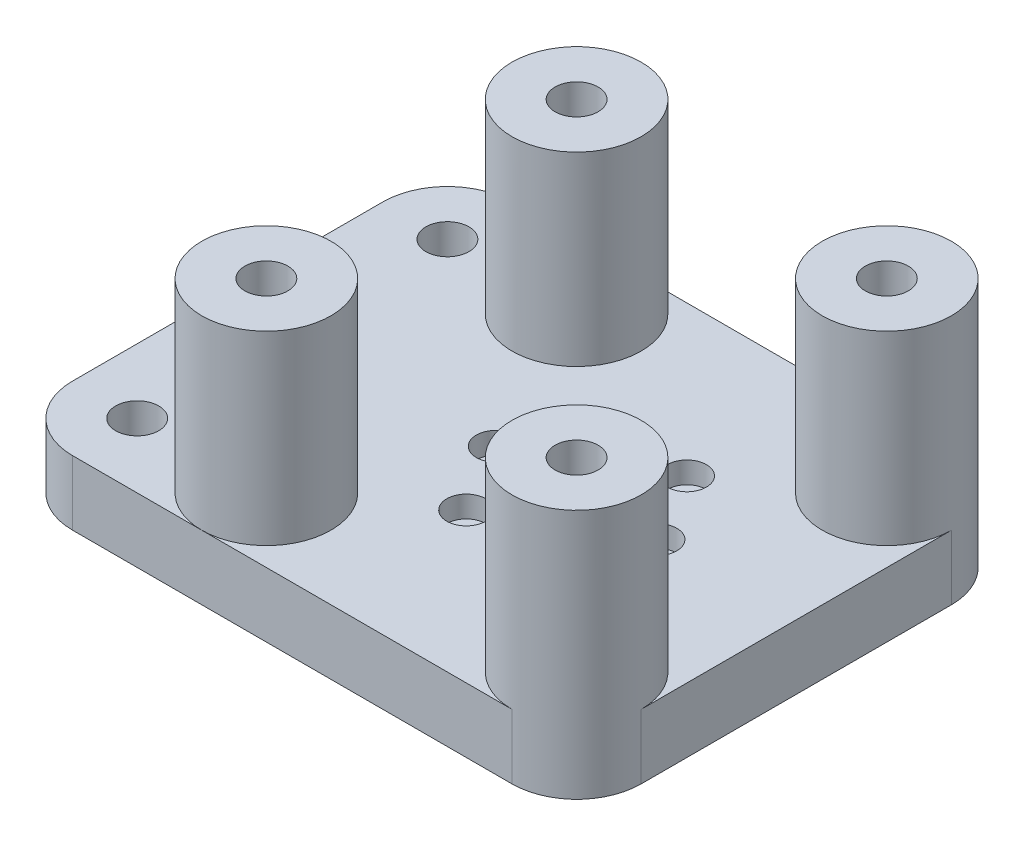
from build123d import *

# Parameters (mm, degrees)
SKETCH1_R                = 4
SKETCH1_R_2              = 10.5
SKETCH1_R_3              = 2
BASE_DEPTH               = 12
SKETCH2_R                = 3.625
BOLT_HEAD_RECESSES_DEPTH = 4
SKETCH3_R                = 12
SKETCH3_R_2              = 4
BOSS_EXTRUDE1_DEPTH      = 34.5


with BuildPart() as part:
    # Sketch1 → base (new body)
    with BuildSketch(Plane(origin=(0, 0, 0), x_dir=(1, 0, 0), z_dir=(0, 1, 0))):
        with BuildLine():
            Line((-52.814601333, 40.814601333), (28.814601333, 40.814601333))
            ThreePointArc((28.814601333, 40.814601333), (37.299882708, 37.299882708), (40.814601333, 28.814601333))
            Line((40.814601333, 28.814601333), (40.814601333, -28.814601333))
            ThreePointArc((40.814601333, -28.814601333), (37.299882708, -37.299882708), (28.814601333, -40.814601333))
            Line((28.814601333, -40.814601333), (-52.814601333, -40.814601333))
            ThreePointArc((-52.814601333, -40.814601333), (-61.299882708, -37.299882708), (-64.814601333, -28.814601333))
            Line((-64.814601333, -28.814601333), (-64.814601333, 28.814601333))
            ThreePointArc((-64.814601333, 28.814601333), (-61.299882708, 37.299882708), (-52.814601333, 40.814601333))
        make_face()
        with Locations((-28.814601333, 28.814601333)):
            Circle(SKETCH1_R, mode=Mode.SUBTRACT)
        with Locations((28.814601333, 28.814601333)):
            Circle(SKETCH1_R, mode=Mode.SUBTRACT)
        with Locations((28.814601333, -28.814601333)):
            Circle(SKETCH1_R, mode=Mode.SUBTRACT)
        with Locations((-28.814601333, -28.814601333)):
            Circle(SKETCH1_R, mode=Mode.SUBTRACT)
        Circle(SKETCH1_R_2, mode=Mode.SUBTRACT)
        with Locations((-7.5, 12.990381057)):
            Circle(SKETCH1_R_3, mode=Mode.SUBTRACT)
        with Locations((7.5, 12.990381057)):
            Circle(SKETCH1_R_3, mode=Mode.SUBTRACT)
        with Locations((15, 0)):
            Circle(SKETCH1_R_3, mode=Mode.SUBTRACT)
        with Locations((7.5, -12.990381057)):
            Circle(SKETCH1_R_3, mode=Mode.SUBTRACT)
        with Locations((-7.5, -12.990381057)):
            Circle(SKETCH1_R_3, mode=Mode.SUBTRACT)
        with Locations((-15, 0)):
            Circle(SKETCH1_R_3, mode=Mode.SUBTRACT)
        with Locations((-52.814601333, 28.814601333)):
            Circle(SKETCH1_R, mode=Mode.SUBTRACT)
        with Locations((-52.814601333, -28.814601333)):
            Circle(SKETCH1_R, mode=Mode.SUBTRACT)
    extrude(amount=BASE_DEPTH)

    # Sketch2 → bolt head recesses (cut)
    with BuildSketch(Plane(origin=(0, 12, 0), x_dir=(1, 0, 0), z_dir=(0, 1, 0))):
        with Locations((-7.5, 12.990381057)):
            Circle(SKETCH2_R)
        with Locations((7.5, 12.990381057)):
            Circle(SKETCH2_R)
        with Locations((15, 0)):
            Circle(SKETCH2_R)
        with Locations((7.5, -12.990381057)):
            Circle(SKETCH2_R)
        with Locations((-7.5, -12.990381057)):
            Circle(SKETCH2_R)
        with Locations((-15, 0)):
            Circle(SKETCH2_R)
    extrude(amount=-BOLT_HEAD_RECESSES_DEPTH, mode=Mode.SUBTRACT)

    # Sketch3 → Boss-Extrude1 (add)
    # profile 1 of 4: a face of its own
    with BuildSketch(Plane(origin=(0, 12, 0), x_dir=(1, 0, 0), z_dir=(0, 1, 0))):
        with Locations((-28.814601333, 28.814601333)):
            Circle(SKETCH3_R)
        with Locations((-28.814601333, 28.814601333)):
            Circle(SKETCH3_R_2, mode=Mode.SUBTRACT)
    # profile 2 of 4: a face of its own
    with BuildSketch(Plane(origin=(0, 12, 0), x_dir=(1, 0, 0), z_dir=(0, 1, 0))):
        with Locations((28.814601333, 28.814601333)):
            Circle(SKETCH3_R)
        with Locations((28.814601333, 28.814601333)):
            Circle(SKETCH3_R_2, mode=Mode.SUBTRACT)
    # profile 3 of 4: a face of its own
    with BuildSketch(Plane(origin=(0, 12, 0), x_dir=(1, 0, 0), z_dir=(0, 1, 0))):
        with Locations((28.814601333, -28.814601333)):
            Circle(SKETCH3_R)
        with Locations((28.814601333, -28.814601333)):
            Circle(SKETCH3_R_2, mode=Mode.SUBTRACT)
    # profile 4 of 4: a face of its own
    with BuildSketch(Plane(origin=(0, 12, 0), x_dir=(1, 0, 0), z_dir=(0, 1, 0))):
        with Locations((-28.814601333, -28.814601333)):
            Circle(SKETCH3_R)
        with Locations((-28.814601333, -28.814601333)):
            Circle(SKETCH3_R_2, mode=Mode.SUBTRACT)
    extrude(amount=BOSS_EXTRUDE1_DEPTH)


solid = part.part
